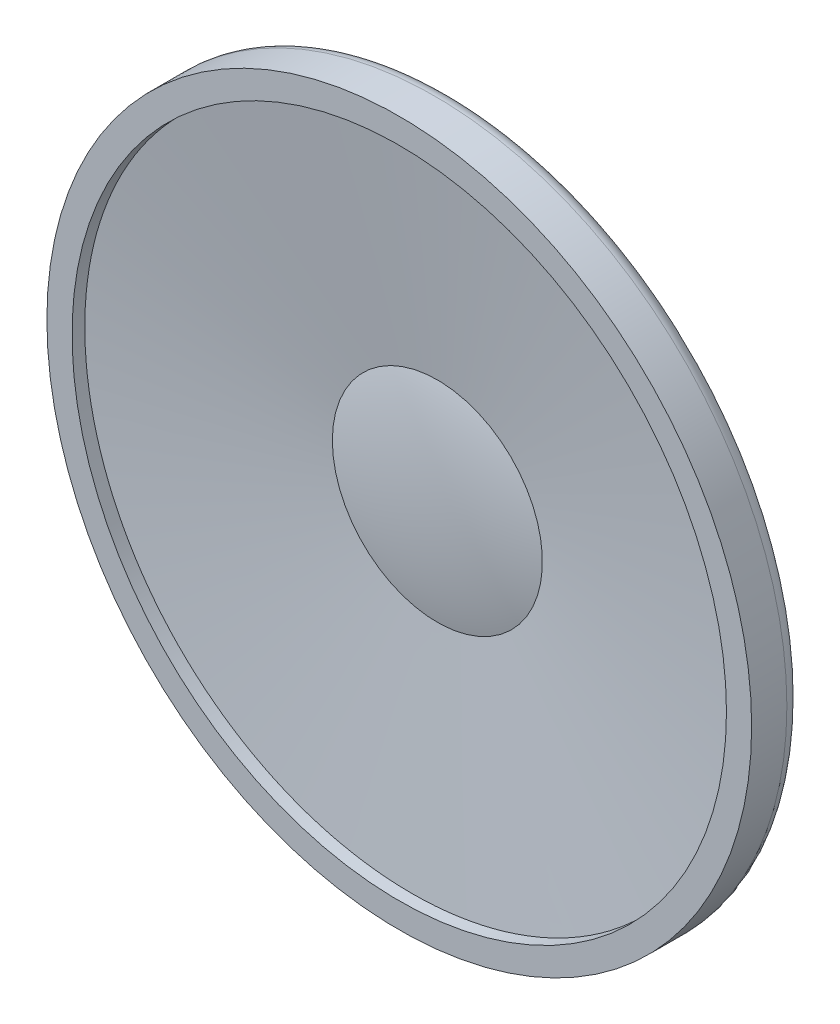
from build123d import *

# Parameters (mm, degrees)
SKETCH1_R            = 14
BOSS_EXTRUDE1_DEPTH  = 2
SKETCH3_R            = 12.5
BOSS_EXTRUDE3_DEPTH  = 1
FILLET1_R            = 0.6
FILLET2_R            = 0.6
SHELL1_START         = -2.5
SHELL1_OUTLINE_R     = 11.5
SHELL1_DEPTH         = 2.5
SHELL1_START_2       = -1
SHELL1_2_OUTLINE_R   = 13
SHELL1_2_OUTLINE_R_2 = 11.5
SHELL1_2_DEPTH       = 1
SKETCH4_R            = 6.625
BOSS_EXTRUDE4_DEPTH  = 2
FILLET3_R            = 0.6
SKETCH5_R            = 1
CUT_EXTRUDE1_DEPTH   = 21.024984534
CIRPATTERN1_COUNT    = 17


# Read off the part's stored shape, not the designer's step: Shell1
with BuildPart() as part:
    # Sketch1 → Boss-Extrude1 (new body)
    with BuildSketch(Plane.XY):
        Circle(SKETCH1_R)
    extrude(amount=-BOSS_EXTRUDE1_DEPTH)

    # Sketch3 → Boss-Extrude3 (add)
    with BuildSketch(Plane(origin=(0, 0, -2), x_dir=(-1, 0, 0), z_dir=(0, 0, -1))):
        with Locations(Location((0, 0, 0), (0, 0, 180))):
            Circle(SKETCH3_R)
    extrude(amount=BOSS_EXTRUDE3_DEPTH)

    # Fillet1
    fillet1_edges = [part.edges().sort_by_distance(p)[0] for p in [
        (-14, 0, -2),
    ]]
    fillet(fillet1_edges, radius=FILLET1_R)

    # Fillet2
    fillet2_edges = [part.edges().sort_by_distance(p)[0] for p in [
        (-12.5, 0, -3),
    ]]
    fillet(fillet2_edges, radius=FILLET2_R)

    # Shell1 outline → Shell1 (cut)
    with BuildSketch(Plane.XY.offset(SHELL1_START)):
        Circle(SHELL1_OUTLINE_R)
    extrude(amount=SHELL1_DEPTH, mode=Mode.SUBTRACT)

    # Shell1 2 outline → Shell1 2 (cut)
    with BuildSketch(Plane.XY.offset(SHELL1_START_2)):
        Circle(SHELL1_2_OUTLINE_R)
        Circle(SHELL1_2_OUTLINE_R_2, mode=Mode.SUBTRACT)
    extrude(amount=SHELL1_2_DEPTH, mode=Mode.SUBTRACT)

    # Sketch4 → Boss-Extrude4 (add)
    with BuildSketch(Plane(origin=(0, 0, -3), x_dir=(-1, 0, 0), z_dir=(0, 0, -1))):
        Circle(SKETCH4_R)
    extrude(amount=BOSS_EXTRUDE4_DEPTH)

    # Fillet3
    fillet3_edges = [part.edges().sort_by_distance(p)[0] for p in [
        (6.625, 0, -5),
    ]]
    fillet(fillet3_edges, radius=FILLET3_R)

    # Sketch5 → Cut-Extrude1 (cut, through all)
    with BuildSketch(Plane(origin=(0, 0, -3), x_dir=(-1, 0, 0), z_dir=(0, 0, -1))):
        with Locations((0, 9.2625)):
            Circle(SKETCH5_R)
    cut_extrude1 = extrude(amount=-CUT_EXTRUDE1_DEPTH, mode=Mode.SUBTRACT)

    # CirPattern1: Cut-Extrude1 ×17 about axis
    cirpattern1_axis = Axis((0, 0, 0), (0, 0, 1))
    for i in range(1, CIRPATTERN1_COUNT):
        add(cut_extrude1.rotate(cirpattern1_axis, i * 360 / CIRPATTERN1_COUNT), mode=Mode.SUBTRACT)


with BuildPart() as body_2:
    # Sketch7 → Revolve2 (revolve)
    with BuildSketch(Plane(origin=(0, 0, 0), x_dir=(1, 0, 0), z_dir=(0, 1, 0))):
        with BuildLine():
            Line((0, 2), (0, 1.06389143))
            add(Edge.make_bspline(
                [(-4.172581723, 1.513911328), (-2.320600441, 1.06389143), (0, 1.06389143)],
                knots=[0, 0, 0, 1, 1, 1], degree=2, weights=[1, 0.948172254, 1]))
            add(Edge.make_bspline(
                [(-13, 0.5), (-6.347883769, 1.267551873), (-4.172581723, 1.513911328)],
                knots=[0, 0, 0, 1, 1, 1], degree=2, weights=[1, 1.163023032, 1]))
            add(Edge.make_bspline(
                [(0, 2), (-6.575813225, 1.907047951), (-13, 0.5)],
                knots=[0, 0, 0, 1, 1, 1], degree=2, weights=[1, 0.658700931, 1]))
        make_face()
    revolve(axis=Axis((0, 0, -2), (0, 0, 1)))


solid = Compound([part.part, body_2.part])
